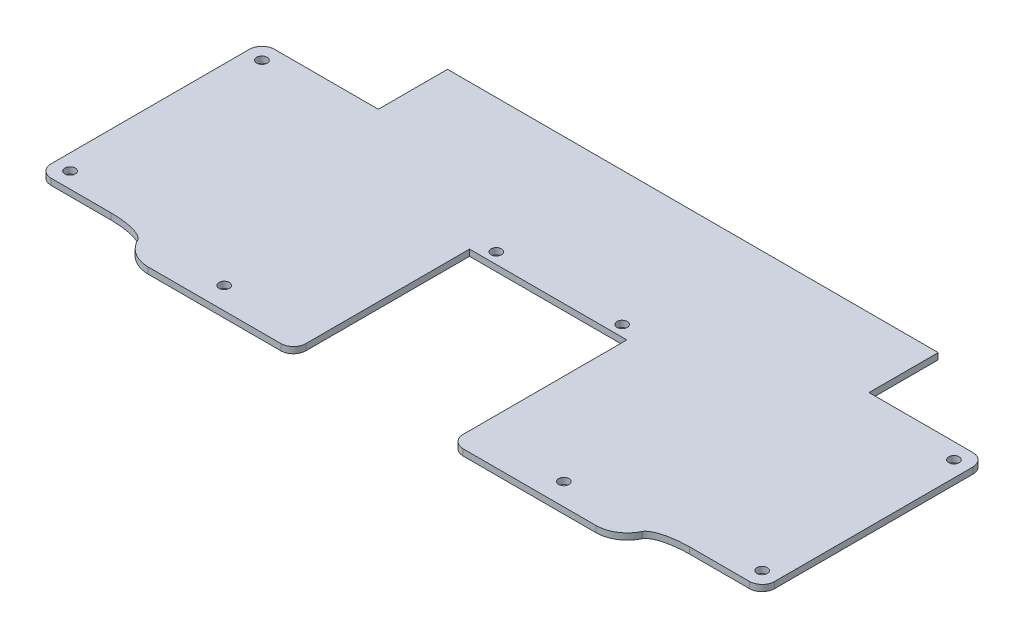
from build123d import *

# Parameters (mm, degrees)
SKETCH1_W           = 230
SKETCH1_H           = 102
BOSS_EXTRUDE1_DEPTH = 2
SKETCH2_W           = 37
SKETCH2_H           = 22
SKETCH2_W_2         = 35
SKETCH2_H_2         = 9
SKETCH2_W_3         = 50
SKETCH2_H_3         = 56
CUT_EXTRUDE1_DEPTH  = 252.610810579
SKETCH3_R           = 1.65
CUT_EXTRUDE2_DEPTH  = 10
FILLET1_R           = 4
FILLET2_SIZE        = 4
FILLET2_SIZE_2      = 12
FILLET3_R           = 10
SKETCH4_R           = 1.65
CUT_EXTRUDE3_DEPTH  = 10


with BuildPart() as part:
    # Sketch1 → Boss-Extrude1 (new body)
    with BuildSketch(Plane(origin=(0, 0, 0), x_dir=(1, 0, 0), z_dir=(0, 1, 0))):
        with Locations((115, 51)):
            Rectangle(SKETCH1_W, SKETCH1_H)
    extrude(amount=BOSS_EXTRUDE1_DEPTH)

    # Sketch2 → Cut-Extrude1 (cut, through all)
    with BuildSketch(Plane(origin=(0, 2, 0), x_dir=(1, 0, 0), z_dir=(0, 1, 0))):
        with Locations((18.5, 91)):
            Rectangle(SKETCH2_W, SKETCH2_H)
        with Locations((17.5, 4.5)):
            Rectangle(SKETCH2_W_2, SKETCH2_H_2)
        with Locations((211.5, 91)):
            Rectangle(SKETCH2_W, SKETCH2_H)
        with Locations((212.5, 4.5)):
            Rectangle(SKETCH2_W_2, SKETCH2_H_2)
        with Locations((115, 28)):
            Rectangle(SKETCH2_W_3, SKETCH2_H_3)
    extrude(amount=-CUT_EXTRUDE1_DEPTH, mode=Mode.SUBTRACT)

    # Sketch3 → Cut-Extrude2 (cut)
    with BuildSketch(Plane.XZ):
        with Locations(Location((5, -14, 0), (0, 0, 270))):
            Circle(SKETCH3_R)
        with Locations(Location((5, -75, 0), (0, 0, 270))):
            Circle(SKETCH3_R)
        with Locations(Location((95, -59.5, 0), (0, 0, 270))):
            Circle(SKETCH3_R)
        with Locations(Location((135, -59.5, 0), (0, 0, 270))):
            Circle(SKETCH3_R)
        with Locations(Location((225, -14, 0), (0, 0, 270))):
            Circle(SKETCH3_R)
        with Locations(Location((225, -75, 0), (0, 0, 270))):
            Circle(SKETCH3_R)
    extrude(amount=-CUT_EXTRUDE2_DEPTH, mode=Mode.SUBTRACT)

    # Fillet1
    fillet1_edges = [part.edges().sort_by_distance(p)[0] for p in [
        (0, 1, -9),
        (230, 1, -80),
        (230, 1, -9),
        (90, 1, 0),
        (140, 1, 0),
        (0, 1, -80),
    ]]
    fillet(fillet1_edges, radius=FILLET1_R)

    # Fillet2
    # an asymmetric fillet: 12, 4 mm, written as the material it adds along each edge
    with BuildSketch(Plane(origin=(195, 2, -9), x_dir=(0, 0, 1), z_dir=(0, -1, 0))) as fillet2_piece_1:
        with BuildLine():
            Bezier((FILLET2_SIZE, 0), (0, 0), (0, -FILLET2_SIZE_2), weights=[1, 0.707106781, 1])
            Line((0, -FILLET2_SIZE_2), (0, 0))
            Line((0, 0), (FILLET2_SIZE, 0))
        make_face()
    extrude(amount=2)
    with BuildSketch(Plane(origin=(35, 2, -9), x_dir=(0, 0, 1), z_dir=(0, -1, 0))) as fillet2_piece_2:
        with BuildLine():
            Bezier((FILLET2_SIZE, 0), (0, 0), (0, FILLET2_SIZE_2), weights=[1, 0.707106781, 1])
            Line((0, FILLET2_SIZE_2), (0, 0))
            Line((0, 0), (FILLET2_SIZE, 0))
        make_face()
    extrude(amount=2)

    # Fillet3
    fillet3_edges = [part.edges().sort_by_distance(p)[0] for p in [
        (35, 1, 0),
        (195, 1, 0),
    ]]
    fillet(fillet3_edges, radius=FILLET3_R)

    # Sketch4 → Cut-Extrude3 (cut)
    with BuildSketch(Plane.XZ):
        with Locations(Location((61, -7, 0), (0, 0, 270))):
            Circle(SKETCH4_R)
        with Locations(Location((169, -7, 0), (0, 0, 270))):
            Circle(SKETCH4_R)
    extrude(amount=-CUT_EXTRUDE3_DEPTH, mode=Mode.SUBTRACT)


solid = part.part
